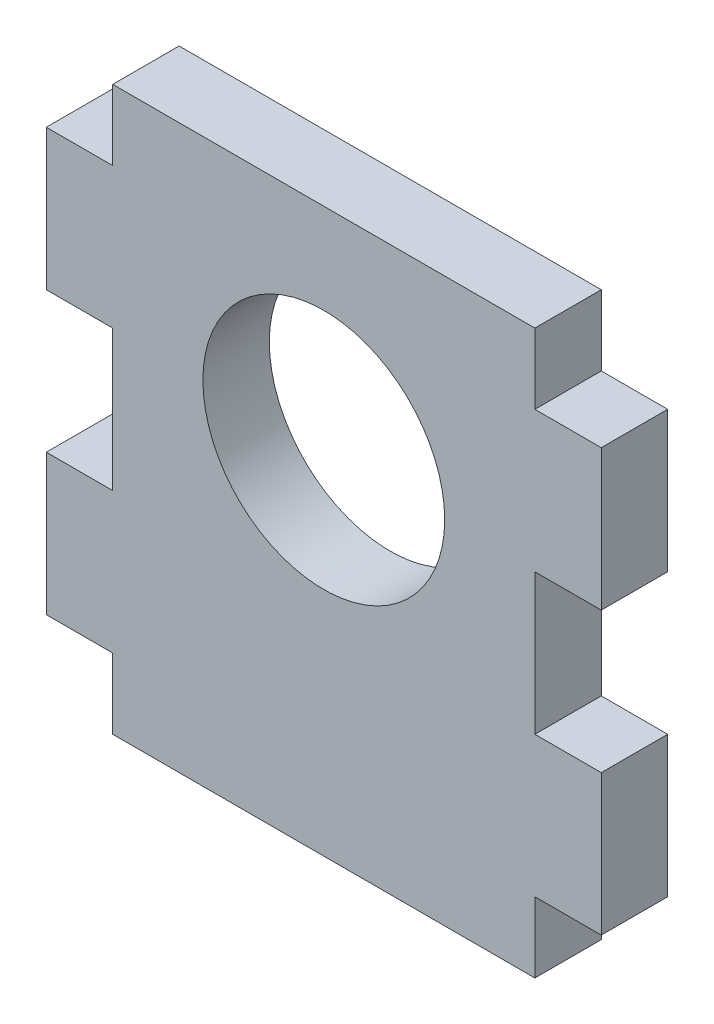
from build123d import *

# Parameters (mm, degrees)
SKETCH1_R           = 10.9125
BOSS_EXTRUDE1_DEPTH = 5.9944


with BuildPart() as part:
    # Sketch1 → Boss-Extrude1 (new body)
    with BuildSketch(Plane.XY):
        Polygon((19.05, 19.05), (-19.05, 19.05), (-19.05, 12.7), (-25.0444, 12.7), (-25.0444, 0), (-19.05, 0), (-19.05, -12.7), (-25.0444, -12.7), (-25.0444, -25.4), (-19.05, -25.4), (-19.05, -31.75), (19.05, -31.75), (19.05, -25.4), (25.0444, -25.4), (25.0444, -12.7), (19.05, -12.7), (19.05, 0), (25.0444, 0), (25.0444, 12.7), (19.05, 12.7), align=None)
        Circle(SKETCH1_R, mode=Mode.SUBTRACT)
    extrude(amount=BOSS_EXTRUDE1_DEPTH)


solid = part.part
